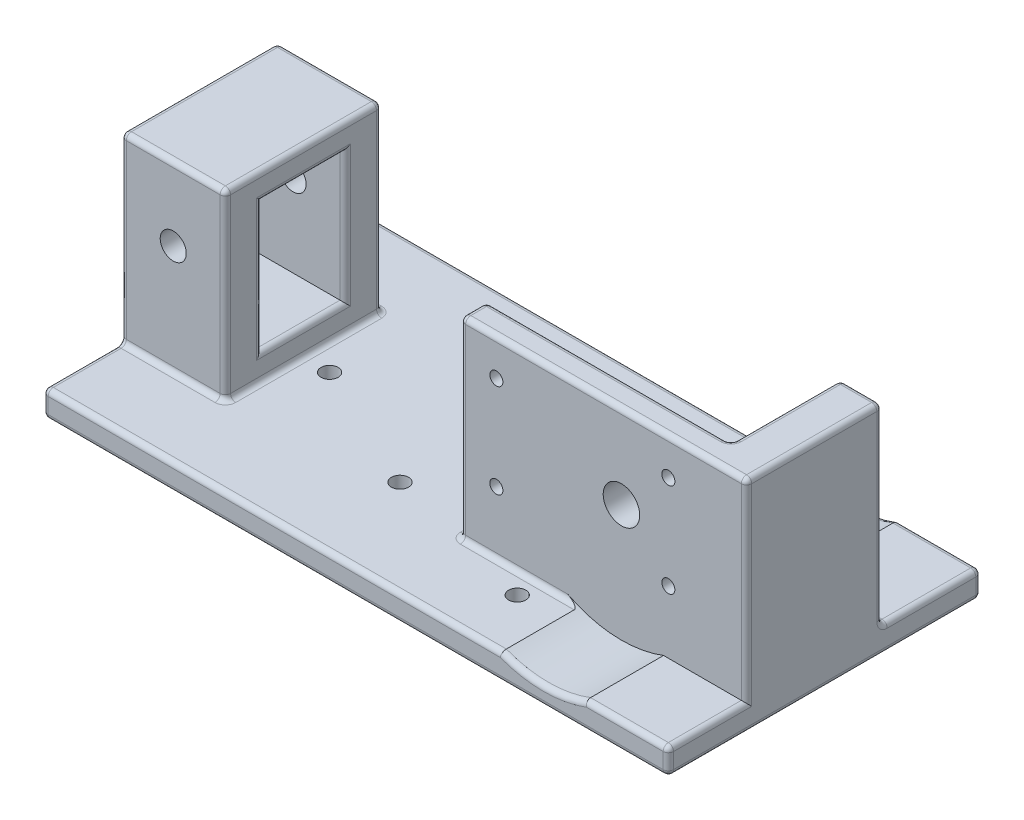
from build123d import *

# Parameters (mm, degrees)
SKETCH_1_W          = 46.9
SKETCH_1_H          = 32
SKETCH_1_R          = 1.25
SKETCH_1_R_2        = 3.5
EXTRUDE_1_DEPTH     = 5
SKETCH_2_W          = 120
SKETCH_2_H          = 30
EXTRUDE_2_DEPTH     = 5
SKETCH_3_W          = 20
SKETCH_3_H          = 7
EXTRUDE_3_DEPTH     = 30
EXTRUDE_3_2_DEPTH   = 30
SKETCH_4_R          = 2.5
CUT_EXTRUDE_1_DEPTH = 96.315266353
SKETCH_5_W          = 20
SKETCH_5_H          = 30
EXTRUDE_4_DEPTH     = 5
SKETCH_6_W          = 120
SKETCH_6_H          = 60
EXTRUDE_5_DEPTH     = 5
CUT_EXTRUDE_START   = -60
SKETCH_7_R          = 22.5
CUT_EXTRUDE_2_DEPTH = 15
CUT_EXTRUDE_START_2 = -18
SKETCH_8_R          = 22.5
CUT_EXTRUDE_3_DEPTH = 18
SKETCH_9_R          = 1.65
CUT_EXTRUDE_4_DEPTH = 5
SKETCH_12_W         = 45.1
SKETCH_12_H         = 5
CUT_EXTRUDE_5_DEPTH = 30
SKETCH_14_W         = 54.9
SKETCH_14_H         = 5
CUT_EXTRUDE_7_DEPTH = 25
SKETCH_15_W         = 8
SKETCH_15_H         = 5
CUT_EXTRUDE_8_DEPTH = 5
FILLET_2_R          = 1
SKETCH_16_W         = 26
SKETCH_16_H         = 37
EXTRUDE_6_DEPTH     = 8
FILLET_3_R          = 1
SKETCH_18_R         = 1.65
CUT_EXTRUDE_9_DEPTH = 5


with BuildPart() as part:
    # 草图1 → 凸台-拉伸1 (new body)
    with BuildSketch(Plane.XY):
        with Locations((0.55, 0)):
            Rectangle(SKETCH_1_W, SKETCH_1_H)
        with Locations((17, 9)):
            Circle(SKETCH_1_R, mode=Mode.SUBTRACT)
        with Locations((17, -9)):
            Circle(SKETCH_1_R, mode=Mode.SUBTRACT)
        with Locations((-16, -9)):
            Circle(SKETCH_1_R, mode=Mode.SUBTRACT)
        with Locations((-16, 9)):
            Circle(SKETCH_1_R, mode=Mode.SUBTRACT)
        with Locations((8, 0)):
            Circle(SKETCH_1_R_2, mode=Mode.SUBTRACT)
    extrude(amount=EXTRUDE_1_DEPTH)

    # 草图2 → 凸台-拉伸2 (add)
    with BuildSketch(Plane.XZ.offset(16)):
        with Locations((-28, -10)):
            Rectangle(SKETCH_2_W, SKETCH_2_H)
    extrude(amount=EXTRUDE_2_DEPTH)



with BuildPart() as body_2:
    # 草图3 → 凸台-拉伸3 (new body)
    with BuildSketch(Plane(origin=(0, -16, 0), x_dir=(1, 0, 0), z_dir=(0, 1, 0))):
        with Locations((-78, -1.5)):
            Rectangle(SKETCH_3_W, SKETCH_3_H)
    extrude(amount=EXTRUDE_3_DEPTH)


with BuildPart() as body_3:
    # 草图3 → Extrude 3 2 (new body)
    with BuildSketch(Plane(origin=(0, -16, 0), x_dir=(1, 0, 0), z_dir=(0, 1, 0))):
        with Locations((-78, 21.5)):
            Rectangle(SKETCH_3_W, SKETCH_3_H)
    extrude(amount=EXTRUDE_3_2_DEPTH)


with BuildPart() as cut_extrude_1_tool:
    # 草图4 → 切除-拉伸1 (new, through all)
    with BuildSketch(Plane.XY.offset(5)):
        with Locations((-78, 0)):
            Circle(SKETCH_4_R)
    extrude(amount=-CUT_EXTRUDE_1_DEPTH)


with BuildPart() as body_2_1:
    add(body_2.part)

    # 切除-拉伸1: cut by cut_extrude_1_tool
    add(cut_extrude_1_tool.part, mode=Mode.SUBTRACT)


with BuildPart() as body_3_1:
    add(body_3.part)

    # 切除-拉伸1: cut by cut_extrude_1_tool
    add(cut_extrude_1_tool.part, mode=Mode.SUBTRACT)


with BuildPart() as part_1:
    add(part.part)

    add(body_2_1.part)  # 凸台-拉伸4 merges body 2

    add(body_3_1.part)  # 凸台-拉伸4 merges body 3
    # 草图5 → 凸台-拉伸4 (add)
    with BuildSketch(Plane(origin=(0, 14, 0), x_dir=(1, 0, 0), z_dir=(0, 1, 0))):
        with Locations((-78, 10)):
            Rectangle(SKETCH_5_W, SKETCH_5_H)
    extrude(amount=-EXTRUDE_4_DEPTH)

    # 草图6 → 凸台-拉伸5 (add)
    with BuildSketch(Plane.XZ.offset(21)):
        with Locations((-28, -10)):
            Rectangle(SKETCH_6_W, SKETCH_6_H)
    extrude(amount=EXTRUDE_5_DEPTH)

    # 草图7 → 切除-拉伸2 (cut)
    with BuildSketch(Plane(origin=(0, 0, -40), x_dir=(-1, 0, 0), z_dir=(0, 0, -1)).offset(CUT_EXTRUDE_START)):
        with Locations((-8, 0)):
            Circle(SKETCH_7_R)
    extrude(amount=CUT_EXTRUDE_2_DEPTH, mode=Mode.SUBTRACT)

    # 草图8 → 切除-拉伸3 (cut)
    with BuildSketch(Plane(origin=(0, 0, -40), x_dir=(-1, 0, 0), z_dir=(0, 0, -1)).offset(CUT_EXTRUDE_START_2)):
        with Locations((-8, 0)):
            Circle(SKETCH_8_R)
    extrude(amount=CUT_EXTRUDE_3_DEPTH, mode=Mode.SUBTRACT)

    # 草图9 → 切除-拉伸4 (cut)
    with BuildSketch(Plane.XZ.offset(26)):
        with Locations(Location((-63, -10, 0), (0, 0, 270))):
            Circle(SKETCH_9_R)
        with Locations(Location((-38, 1.5, 0), (0, 0, 270))):
            Circle(SKETCH_9_R)
        with Locations(Location((-38, -21.5, 0), (0, 0, 270))):
            Circle(SKETCH_9_R)
    extrude(amount=-CUT_EXTRUDE_4_DEPTH, mode=Mode.SUBTRACT)

    # 草图12 → 切除-拉伸5 (cut)
    with BuildSketch(Plane(origin=(0, 0, -25), x_dir=(-1, 0, 0), z_dir=(0, 0, -1))):
        with Locations((45.45, -18.5)):
            Rectangle(SKETCH_12_W, SKETCH_12_H)
    extrude(amount=-CUT_EXTRUDE_5_DEPTH, mode=Mode.SUBTRACT)

    # 草图14 → 切除-拉伸7 (cut)
    with BuildSketch(Plane(origin=(0, 0, -25), x_dir=(-1, 0, 0), z_dir=(0, 0, -1))):
        with Locations((-4.55, -18.5)):
            Rectangle(SKETCH_14_W, SKETCH_14_H)
    extrude(amount=-CUT_EXTRUDE_7_DEPTH, mode=Mode.SUBTRACT)

    # 草图15 → 切除-拉伸8 (cut)
    with BuildSketch(Plane(origin=(0, 0, 0), x_dir=(-1, 0, 0), z_dir=(0, 0, -1))):
        with Locations((-28, -18.5)):
            Rectangle(SKETCH_15_W, SKETCH_15_H)
    extrude(amount=-CUT_EXTRUDE_8_DEPTH, mode=Mode.SUBTRACT)

    # 圆角2
    fillet_2_edges = [part_1.edges().sort_by_distance(p)[0] for p in [
        (-88, -21, 12.5),
        (-88, -21, -32.5),
        (-88, -23.5, 20),
        (-44.038873605, -21, -40),
        (-88, -23.5, -40),
        (32, -23.5, -40),
        (24.038873605, -21, 20),
        (32, -23.5, 20),
        (-88, -26, -10),
        (-28, -26, -40),
        (-28, -26, 20),
        (-44.038873605, -21, 20),
        (-11.488873605, -21, 5),
        (8, -22.5, 20),
        (24.038873605, -21, -40),
        (8, -22.5, -40),
        (-78, -21, 5),
        (-68, -21, -10),
        (-22.9, -21, 2.5),
        (-68, -16, -10),
        (8, -22.5, -22),
        (0.55, -21, 0),
        (-88, -3.5, 5),
        (-88, -3.5, -25),
        (-78, -21, -25),
        (-22.9, -2.5, 5),
        (-88, -16, -10),
        (-68, -3.5, 5),
        (-88, 14, -10),
        (-78, 14, 5),
        (-68, 14, -10),
        (-22.9, -2.5, 0),
        (-68, -3.5, -25),
        (-78, 14, -25),
        (-68, -3.5, -18),
        (-88, -3.5, -18),
        (-88, -3.5, -2),
        (-68, -3.5, -2),
        (-22.9, 16, 2.5),
        (-68, 9, -10),
        (-88, 9, -10),
    ]]
    fillet(fillet_2_edges, radius=FILLET_2_R)

    # 草图16 → 凸台-拉伸6 (add)
    with BuildSketch(Plane(origin=(24, 0, 0), x_dir=(0, 0, -1), z_dir=(1, 0, 0))):
        with Locations((8, -2.5)):
            Rectangle(SKETCH_16_W, SKETCH_16_H)
    extrude(amount=EXTRUDE_6_DEPTH)

    # 圆角3
    # the kernel refuses this fillet: 1 mm, written as the material it takes off along each edge
    with BuildSketch(Plane(origin=(-21.9, 15, 4), x_dir=(0, 0, 1), z_dir=(0, 1, 0))) as fillet_3_piece_1_section:
        Polygon((0, 0), (FILLET_3_R, 0), (FILLET_3_R, -FILLET_3_R), (0, -FILLET_3_R), align=None)
    fillet_3_piece_1 = extrude(amount=FILLET_3_R, mode=Mode.PRIVATE)
    fillet_3_piece_1 = fillet_3_piece_1 - Plane(origin=(-21.9, 15, 4), x_dir=(0.7071067811865475, 0, -0.7071067811865475), z_dir=(0, 1, 0)) * Sphere(FILLET_3_R, mode=Mode.PRIVATE)
    add(fillet_3_piece_1, mode=Mode.SUBTRACT)
    with BuildSketch(Plane(origin=(31, -22, 19), x_dir=(1, 0, 0), z_dir=(0, 1, 0))) as fillet_3_piece_2_section:
        Polygon((0, 0), (FILLET_3_R, 0), (FILLET_3_R, -FILLET_3_R), (0, -FILLET_3_R), align=None)
    fillet_3_piece_2 = extrude(amount=FILLET_3_R, mode=Mode.PRIVATE)
    fillet_3_piece_2 = fillet_3_piece_2 - Plane(origin=(31, -22, 19), x_dir=(-0.7071067811865474, 0, -0.7071067811865477), z_dir=(0, 1, 0)) * Sphere(FILLET_3_R, mode=Mode.PRIVATE)
    add(fillet_3_piece_2, mode=Mode.SUBTRACT)
    with BuildSketch(Plane(origin=(31, -25, 19), x_dir=(0, -1, 0), z_dir=(1, 0, 0))) as fillet_3_piece_3_section:
        Polygon((0, 0), (FILLET_3_R, 0), (FILLET_3_R, -FILLET_3_R), (0, -FILLET_3_R), align=None)
    fillet_3_piece_3 = extrude(amount=FILLET_3_R, mode=Mode.PRIVATE)
    fillet_3_piece_3 = fillet_3_piece_3 - Plane(origin=(31, -25, 19), x_dir=(0, 0.7071067811865475, -0.7071067811865475), z_dir=(1, 0, 0)) * Sphere(FILLET_3_R, mode=Mode.PRIVATE)
    add(fillet_3_piece_3, mode=Mode.SUBTRACT)
    with BuildSketch(Plane(origin=(31, -25, -39), x_dir=(0, -1, 0), z_dir=(1, 0, 0))) as fillet_3_piece_4_section:
        Polygon((0, 0), (FILLET_3_R, 0), (FILLET_3_R, FILLET_3_R), (0, FILLET_3_R), align=None)
    fillet_3_piece_4 = extrude(amount=FILLET_3_R, mode=Mode.PRIVATE)
    fillet_3_piece_4 = fillet_3_piece_4 - Plane(origin=(31, -25, -39), x_dir=(0, 0.7071067811865475, 0.7071067811865475), z_dir=(1, 0, 0)) * Sphere(FILLET_3_R, mode=Mode.PRIVATE)
    add(fillet_3_piece_4, mode=Mode.SUBTRACT)
    with BuildSketch(Plane(origin=(31, 15, 4), x_dir=(0, 0, 1), z_dir=(1, 0, 0))) as fillet_3_piece_5_section:
        Polygon((0, 0), (FILLET_3_R, 0), (FILLET_3_R, -FILLET_3_R), (0, -FILLET_3_R), align=None)
    fillet_3_piece_5 = extrude(amount=FILLET_3_R, mode=Mode.PRIVATE)
    fillet_3_piece_5 = fillet_3_piece_5 - Plane(origin=(31, 15, 4), x_dir=(0, -0.7071067811865475, -0.7071067811865475), z_dir=(1, 0, 0)) * Sphere(FILLET_3_R, mode=Mode.PRIVATE)
    add(fillet_3_piece_5, mode=Mode.SUBTRACT)
    with BuildSketch(Plane(origin=(31, 16, 5), x_dir=(0, 0, -1), z_dir=(-1, 0, 0))) as fillet_3_piece_6:
        with BuildLine():
            CenterArc((FILLET_3_R, FILLET_3_R), FILLET_3_R, 180, 90)
            Line((0, FILLET_3_R), (0, 0))
            Line((0, 0), (FILLET_3_R, 0))
        make_face()
    extrude(amount=52.9, mode=Mode.SUBTRACT)
    with BuildSketch(Plane(origin=(32, -26, 19), x_dir=(0, 1, 0), z_dir=(0, 0, -1))) as fillet_3_piece_7:
        with BuildLine():
            CenterArc((FILLET_3_R, -FILLET_3_R), FILLET_3_R, 90, 90)
            Line((0, -FILLET_3_R), (0, 0))
            Line((0, 0), (FILLET_3_R, 0))
        make_face()
    extrude(amount=58, mode=Mode.SUBTRACT)
    with BuildSketch(Plane(origin=(32, -21, 19), x_dir=(-1, 0, 0), z_dir=(0, 0, -1))) as fillet_3_piece_8:
        with BuildLine():
            CenterArc((FILLET_3_R, -FILLET_3_R), FILLET_3_R, 90, 90)
            Line((0, -FILLET_3_R), (0, 0))
            Line((0, 0), (FILLET_3_R, 0))
        make_face()
    extrude(amount=14, mode=Mode.SUBTRACT)
    with BuildSketch(Plane(origin=(32, 16, -23.5), x_dir=(0, -1, 0), z_dir=(0, 0, 1))) as fillet_3_piece_9:
        with BuildLine():
            CenterArc((FILLET_3_R, -FILLET_3_R), FILLET_3_R, 90, 90)
            Line((0, -FILLET_3_R), (0, 0))
            Line((0, 0), (FILLET_3_R, 0))
        make_face()
    extrude(amount=27.5, mode=Mode.SUBTRACT)
    with BuildSketch(Plane(origin=(21.5, 16, -21), x_dir=(0, 0, 1), z_dir=(1, 0, 0))) as fillet_3_piece_10:
        with BuildLine():
            CenterArc((FILLET_3_R, FILLET_3_R), FILLET_3_R, 180, 90)
            Line((0, FILLET_3_R), (0, 0))
            Line((0, 0), (FILLET_3_R, 0))
        make_face()
    extrude(amount=13, mode=Mode.SUBTRACT)
    with BuildSketch(Plane(origin=(24, -21, -21), x_dir=(0, 0, 1), z_dir=(0, 1, 0))) as fillet_3_piece_11:
        with BuildLine():
            CenterArc((FILLET_3_R, FILLET_3_R), FILLET_3_R, 180, 90)
            Line((0, FILLET_3_R), (0, 0))
            Line((0, 0), (FILLET_3_R, 0))
        make_face()
    extrude(amount=39.5, mode=Mode.SUBTRACT)
    with BuildSketch(Plane(origin=(32, 15, 5), x_dir=(0, 0, -1), z_dir=(0, -1, 0))) as fillet_3_piece_12:
        with BuildLine():
            CenterArc((FILLET_3_R, -FILLET_3_R), FILLET_3_R, 90, 90)
            Line((0, -FILLET_3_R), (0, 0))
            Line((0, 0), (FILLET_3_R, 0))
        make_face()
    extrude(amount=36, mode=Mode.SUBTRACT)
    with BuildSketch(Plane(origin=(32, -21, 19), x_dir=(-1, 0, 0), z_dir=(0, 0, -1))) as fillet_3_piece_13a_section:
        with BuildLine():
            CenterArc((FILLET_3_R, -FILLET_3_R), FILLET_3_R, 90, 90)
            Line((0, -FILLET_3_R), (0, 0))
            Line((0, 0), (FILLET_3_R, 0))
        make_face()
    fillet_3_piece_13a = extrude(amount=16.5, mode=Mode.PRIVATE)
    fillet_3_piece_13a = split(fillet_3_piece_13a, bisect_by=Plane(origin=(31.773604886, -21.226395114, 5), z_dir=(0, 0, -1)), keep=Keep.TOP, mode=Mode.PRIVATE)
    with BuildSketch(Plane(origin=(32, 15, 5), x_dir=(0, 0, -1), z_dir=(0, -1, 0))) as fillet_3_piece_13b_section:
        with BuildLine():
            CenterArc((FILLET_3_R, -FILLET_3_R), FILLET_3_R, 90, 90)
            Line((0, -FILLET_3_R), (0, 0))
            Line((0, 0), (FILLET_3_R, 0))
        make_face()
    fillet_3_piece_13b = extrude(amount=38.5, mode=Mode.PRIVATE)
    fillet_3_piece_13b = split(fillet_3_piece_13b, bisect_by=Plane(origin=(31.773604886, -21, 4.773604886), z_dir=(0, -1, 0)), keep=Keep.TOP, mode=Mode.PRIVATE)
    fillet_3_piece_13 = fillet_3_piece_13a & fillet_3_piece_13b
    add(fillet_3_piece_13, mode=Mode.SUBTRACT)
    # the kernel refuses this fillet: 1 mm, written as the material it adds along each edge
    with BuildSketch(Plane(origin=(24, 16, 0), x_dir=(-1, 0, 0), z_dir=(0, -1, 0))) as fillet_3_2_piece_1:
        with BuildLine():
            CenterArc((FILLET_3_R, FILLET_3_R), FILLET_3_R, 180, 90)
            Line((0, FILLET_3_R), (0, 0))
            Line((0, 0), (FILLET_3_R, 0))
        make_face()
    extrude(amount=36)
    with BuildSketch(Plane(origin=(24, -20, -1), x_dir=(0, 0, 1), z_dir=(0, 1, 0))) as fillet_3_2_piece_2:
        with BuildLine():
            CenterArc((1 - FILLET_3_R, -FILLET_3_R), FILLET_3_R, 0, 90)
            Line((1 - FILLET_3_R, 0), (1, 0))
            Line((1, 0), (1, -FILLET_3_R))
        make_face()
    revolve(axis=Axis((24, -20, -1), (1, 0, 0)), revolution_arc=90)
    with BuildSketch(Plane(origin=(25, -21, -21), x_dir=(0, 0, -1), z_dir=(1, 0, 0))) as fillet_3_2_piece_3:
        with BuildLine():
            CenterArc((FILLET_3_R, FILLET_3_R), FILLET_3_R, 180, 90)
            Line((0, FILLET_3_R), (0, 0))
            Line((0, 0), (FILLET_3_R, 0))
        make_face()
    extrude(amount=7)
    with BuildSketch(Plane(origin=(24, -21, -1), x_dir=(-1, 0, 0), z_dir=(0, 0, -1))) as fillet_3_2_piece_4:
        with BuildLine():
            CenterArc((FILLET_3_R, FILLET_3_R), FILLET_3_R, 180, 90)
            Line((0, FILLET_3_R), (0, 0))
            Line((0, 0), (FILLET_3_R, 0))
        make_face()
    extrude(amount=19)
    with BuildSketch(Plane(origin=(25, -21, -20), x_dir=(-1, 0, 0), z_dir=(0, 0, 1))) as fillet_3_2_piece_5:
        with BuildLine():
            CenterArc((1 + FILLET_3_R, -FILLET_3_R), FILLET_3_R, 90, 90)
            Line((1, -FILLET_3_R), (1, 0))
            Line((1, 0), (1 + FILLET_3_R, 0))
        make_face()
    revolve(axis=Axis((25, -21, -20), (0, -1, 0)), revolution_arc=90)
    # the kernel refuses this fillet: 1 mm, written as the material it takes off along each edge
    with BuildSketch(Plane(origin=(-21.9, 15, 1), x_dir=(0, 1, 0), z_dir=(0, 0, -1))) as fillet_3_3_piece_1_section:
        Polygon((0, 0), (FILLET_3_R, 0), (FILLET_3_R, -FILLET_3_R), (0, -FILLET_3_R), align=None)
    fillet_3_3_piece_1 = extrude(amount=FILLET_3_R, mode=Mode.PRIVATE)
    fillet_3_3_piece_1 = fillet_3_3_piece_1 - Plane(origin=(-21.9, 15, 1), x_dir=(0.7071067811865475, -0.7071067811865475, 0), z_dir=(0, 0, -1)) * Sphere(FILLET_3_R, mode=Mode.PRIVATE)
    add(fillet_3_3_piece_1, mode=Mode.SUBTRACT)
    with BuildSketch(Plane(origin=(31, -22, -39), x_dir=(1, 0, 0), z_dir=(0, 1, 0))) as fillet_3_3_piece_2_section:
        Polygon((0, 0), (FILLET_3_R, 0), (FILLET_3_R, FILLET_3_R), (0, FILLET_3_R), align=None)
    fillet_3_3_piece_2 = extrude(amount=FILLET_3_R, mode=Mode.PRIVATE)
    fillet_3_3_piece_2 = fillet_3_3_piece_2 - Plane(origin=(31, -22, -39), x_dir=(-0.7071067811865476, 0, 0.7071067811865474), z_dir=(0, 1, 0)) * Sphere(FILLET_3_R, mode=Mode.PRIVATE)
    add(fillet_3_3_piece_2, mode=Mode.SUBTRACT)
    with BuildSketch(Plane(origin=(31, 15, -20), x_dir=(0, 0, -1), z_dir=(1, 0, 0))) as fillet_3_3_piece_3_section:
        Polygon((0, 0), (FILLET_3_R, 0), (FILLET_3_R, FILLET_3_R), (0, FILLET_3_R), align=None)
    fillet_3_3_piece_3 = extrude(amount=FILLET_3_R, mode=Mode.PRIVATE)
    fillet_3_3_piece_3 = fillet_3_3_piece_3 - Plane(origin=(31, 15, -20), x_dir=(0, -0.7071067811865475, 0.7071067811865475), z_dir=(1, 0, 0)) * Sphere(FILLET_3_R, mode=Mode.PRIVATE)
    add(fillet_3_3_piece_3, mode=Mode.SUBTRACT)
    with BuildSketch(Plane(origin=(25, 15, -20), x_dir=(0, 1, 0), z_dir=(-1, 0, 0))) as fillet_3_3_piece_4_section:
        Polygon((0, 0), (FILLET_3_R, 0), (FILLET_3_R, FILLET_3_R), (0, FILLET_3_R), align=None)
    fillet_3_3_piece_4 = extrude(amount=FILLET_3_R, mode=Mode.PRIVATE)
    fillet_3_3_piece_4 = fillet_3_3_piece_4 - Plane(origin=(25, 15, -20), x_dir=(0, -0.7071067811865475, 0.7071067811865475), z_dir=(-1, 0, 0)) * Sphere(FILLET_3_R, mode=Mode.PRIVATE)
    add(fillet_3_3_piece_4, mode=Mode.SUBTRACT)
    with BuildSketch(Plane(origin=(32, -21, -22), x_dir=(-1, 0, 0), z_dir=(0, 0, -1))) as fillet_3_3_piece_5:
        with BuildLine():
            CenterArc((FILLET_3_R, -FILLET_3_R), FILLET_3_R, 90, 90)
            Line((0, -FILLET_3_R), (0, 0))
            Line((0, 0), (FILLET_3_R, 0))
        make_face()
    extrude(amount=17, mode=Mode.SUBTRACT)
    with BuildSketch(Plane(origin=(24, 16, -20), x_dir=(0, -1, 0), z_dir=(0, 0, 1))) as fillet_3_3_piece_6:
        with BuildLine():
            CenterArc((FILLET_3_R, FILLET_3_R), FILLET_3_R, 180, 90)
            Line((0, FILLET_3_R), (0, 0))
            Line((0, 0), (FILLET_3_R, 0))
        make_face()
    extrude(amount=19, mode=Mode.SUBTRACT)
    with BuildSketch(Plane(origin=(32, -20, -21), x_dir=(0, 0, 1), z_dir=(0, 1, 0))) as fillet_3_3_piece_7:
        with BuildLine():
            CenterArc((FILLET_3_R, -FILLET_3_R), FILLET_3_R, 90, 90)
            Line((0, -FILLET_3_R), (0, 0))
            Line((0, 0), (FILLET_3_R, 0))
        make_face()
    extrude(amount=35, mode=Mode.SUBTRACT)
    with BuildSketch(Plane(origin=(-21.9, 16, 0), x_dir=(0, -1, 0), z_dir=(1, 0, 0))) as fillet_3_3_piece_8:
        with BuildLine():
            CenterArc((FILLET_3_R, -FILLET_3_R), FILLET_3_R, 90, 90)
            Line((0, -FILLET_3_R), (0, 0))
            Line((0, 0), (FILLET_3_R, 0))
        make_face()
    extrude(amount=44.9, mode=Mode.SUBTRACT)
    with BuildSketch(Plane(origin=(23, 16, -1), x_dir=(0, 0, 1), z_dir=(-1, 0, 0))) as fillet_3_3_piece_9:
        with BuildLine():
            CenterArc((1 + FILLET_3_R, -FILLET_3_R), FILLET_3_R, 90, 90)
            Line((1, -FILLET_3_R), (1, 0))
            Line((1, 0), (1 + FILLET_3_R, 0))
        make_face()
    revolve(axis=Axis((23, 16, -1), (0, 1, 0)), revolution_arc=90, mode=Mode.SUBTRACT)
    with BuildSketch(Plane(origin=(32, -20, -22), x_dir=(0, -1, 0), z_dir=(0, 0, -1))) as fillet_3_3_piece_10:
        with BuildLine():
            CenterArc((1 + FILLET_3_R, FILLET_3_R), FILLET_3_R, 180, 90)
            Line((1, FILLET_3_R), (1, 0))
            Line((1, 0), (1 + FILLET_3_R, 0))
        make_face()
    revolve(axis=Axis((32, -20, -22), (-1, 0, 0)), revolution_arc=90, mode=Mode.SUBTRACT)

    # 草图18 → 切除-拉伸9 (cut)
    with BuildSketch(Plane.XZ.offset(26)):
        with Locations(Location((-8, -29, 0), (0, 0, 270))):
            Circle(SKETCH_18_R)
        with Locations(Location((-8, -10, 0), (0, 0, 270))):
            Circle(SKETCH_18_R)
        with Locations(Location((-8, 9, 0), (0, 0, 270))):
            Circle(SKETCH_18_R)
    extrude(amount=-CUT_EXTRUDE_9_DEPTH, mode=Mode.SUBTRACT)


solid = part_1.part
